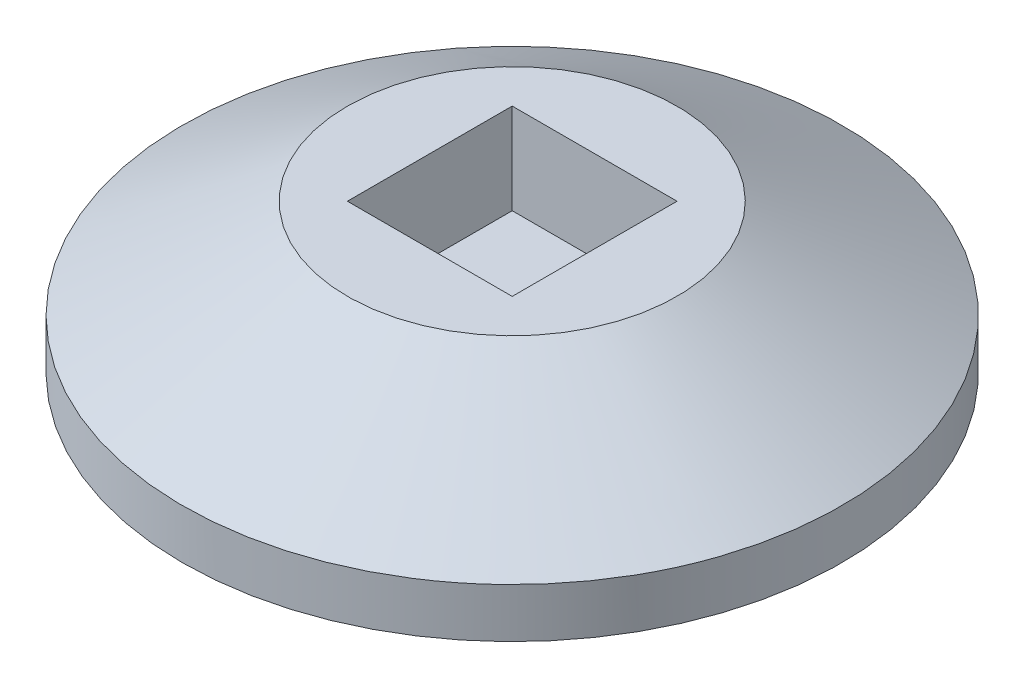
from build123d import *

# Parameters (mm, degrees)
SKETCH1_R           = 20
BOSS_EXTRUDE1_DEPTH = 1.5
SKETCH5_W           = 10
SKETCH5_H           = 10
CUT_EXTRUDE1_DEPTH  = 5.5


with BuildPart() as part:
    # Sketch1 → Boss-Extrude1 (new, symmetric)
    with BuildSketch(Plane(origin=(0, 0, 0), x_dir=(1, 0, 0), z_dir=(0, 1, 0))):
        with Locations(Location((0, 0, 0), (0, 0, 270))):
            Circle(SKETCH1_R)
    extrude(amount=BOSS_EXTRUDE1_DEPTH, both=True)

    # Loft1: read off the stored shape, not the designer's step
    # Loft1: loft between two sections, ruled curve by curve
    loft1_from = [
        Edge.make_bspline([(-6.427341281, 7.5, -7.660893163), (8.894445045, 7.5, -20.515575726), (21.749127607, 7.5, -5.1937894), (6.427341281, 7.5, 7.660893163), (-8.894445045, 7.5, 20.515575726), (-21.749127607, 7.5, 5.1937894), (-6.427341281, 7.5, -7.660893163)], [0, 0, 0, 0, 0.5, 0.5, 0.5, 1, 1, 1, 1], 3, [1, 0.333333333, 0.333333333, 1, 0.333333333, 0.333333333, 1]),
    ]
    loft1_to = [
        Edge.make_bspline([(-15.74903345, 1.5, -12.327527951), (8.906022452, 1.5, -43.825594852), (40.404089352, 1.5, -19.17053895), (15.74903345, 1.5, 12.327527951), (-8.906022452, 1.5, 43.825594852), (-40.404089352, 1.5, 19.17053895), (-15.74903345, 1.5, -12.327527951)], [0, 0, 0, 0, 0.5, 0.5, 0.5, 1, 1, 1, 1], 3, [1, 0.333333333, 0.333333333, 1, 0.333333333, 0.333333333, 1]),
    ]
    loft1 = Solid(Shell([*[Face.make_surface_from_curves(loft1_from[k], loft1_to[k]) for k in range(1)], Face(Wire(loft1_from)), Face(Wire(loft1_to))]))
    add(loft1)

    # Sketch5 → Cut-Extrude1 (cut)
    with BuildSketch(Plane(origin=(0, 7.5, 0), x_dir=(1, 0, 0), z_dir=(0, 1, 0))):
        Rectangle(SKETCH5_W, SKETCH5_H)
    extrude(amount=-CUT_EXTRUDE1_DEPTH, mode=Mode.SUBTRACT)


solid = part.part
